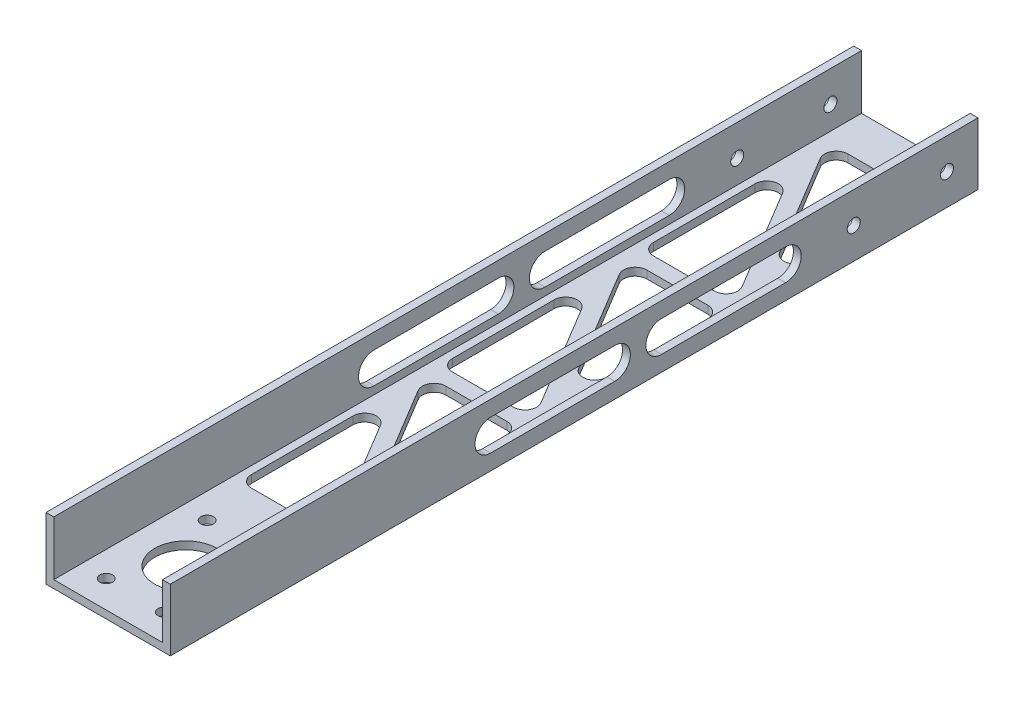
from build123d import *

# Parameters (mm, degrees)
BOSS_EXTRUDE1_DEPTH = 330.2
CUT_EXTRUDE1_REACH  = 337.049
SKETCH2_R           = 12.7
SKETCH3_R           = 2.667
CUT_EXTRUDE2_DEPTH  = 336.04901134
CUT_EXTRUDE3_REACH  = 337.049
SKETCH4_R           = 2.5908
CUT_EXTRUDE4_REACH  = 337.049
CUT_EXTRUDE5_DEPTH  = 336.04901134


with BuildPart() as part:
    # Sketch1 → Boss-Extrude1 (new body)
    with BuildSketch(Plane.XY):
        Polygon((47.625, 3.175), (47.625, 25.4), (50.8, 25.4), (50.8, 0), (0, 0), (0, 25.4), (3.175, 25.4), (3.175, 3.175), align=None)
    extrude(amount=BOSS_EXTRUDE1_DEPTH)

    # Sketch2 → Cut-Extrude1 (cut, up to next)
    with BuildSketch(Plane.XZ, mode=Mode.PRIVATE) as cut_extrude1_sk1:
        with Locations((25.4, 298.45)):
            Circle(SKETCH2_R)
    cut_extrude1_tool1 = extrude(cut_extrude1_sk1.sketch, amount=-CUT_EXTRUDE1_REACH, mode=Mode.PRIVATE) & part.part
    add(cut_extrude1_tool1.solids().sort_by_distance((25.4, 0, 298.45))[0], mode=Mode.SUBTRACT)

    # Sketch3 → Cut-Extrude2 (cut, through all)
    with BuildSketch(Plane(origin=(50.8, 0, 0), x_dir=(0, 0, -1), z_dir=(1, 0, 0))):
        with Locations((-12.7, 12.7)):
            Circle(SKETCH3_R)
        with Locations((-50.8, 12.7)):
            Circle(SKETCH3_R)
    extrude(amount=-CUT_EXTRUDE2_DEPTH, mode=Mode.SUBTRACT)

    # Sketch4 → Cut-Extrude3 (cut, up to next)
    with BuildSketch(Plane.XZ, mode=Mode.PRIVATE) as cut_extrude3_sk1:
        with Locations((13.49375, 277.827770072)):
            Circle(SKETCH4_R)
    cut_extrude3_tool1 = extrude(cut_extrude3_sk1.sketch, amount=-CUT_EXTRUDE3_REACH, mode=Mode.PRIVATE) & part.part
    # Sketch4 → Cut-Extrude3 (cut, up to next)
    with BuildSketch(Plane.XZ, mode=Mode.PRIVATE) as cut_extrude3_sk2:
        with Locations((37.30625, 277.827770072)):
            Circle(SKETCH4_R)
    cut_extrude3_tool2 = extrude(cut_extrude3_sk2.sketch, amount=-CUT_EXTRUDE3_REACH, mode=Mode.PRIVATE) & part.part
    # Sketch4 → Cut-Extrude3 (cut, up to next)
    with BuildSketch(Plane.XZ, mode=Mode.PRIVATE) as cut_extrude3_sk3:
        with Locations((13.49375, 319.072229928)):
            Circle(SKETCH4_R)
    cut_extrude3_tool3 = extrude(cut_extrude3_sk3.sketch, amount=-CUT_EXTRUDE3_REACH, mode=Mode.PRIVATE) & part.part
    # Sketch4 → Cut-Extrude3 (cut, up to next)
    with BuildSketch(Plane.XZ, mode=Mode.PRIVATE) as cut_extrude3_sk4:
        with Locations((37.30625, 319.072229928)):
            Circle(SKETCH4_R)
    cut_extrude3_tool4 = extrude(cut_extrude3_sk4.sketch, amount=-CUT_EXTRUDE3_REACH, mode=Mode.PRIVATE) & part.part
    add(cut_extrude3_tool1.solids().sort_by_distance((13.49375, 0, 277.82777))[0], mode=Mode.SUBTRACT)
    add(cut_extrude3_tool2.solids().sort_by_distance((37.30625, 0, 277.82777))[0], mode=Mode.SUBTRACT)
    add(cut_extrude3_tool3.solids().sort_by_distance((13.49375, 0, 319.07223))[0], mode=Mode.SUBTRACT)
    add(cut_extrude3_tool4.solids().sort_by_distance((37.30625, 0, 319.07223))[0], mode=Mode.SUBTRACT)

    # Sketch5 → Cut-Extrude4 (cut, up to next)
    with BuildSketch(Plane.XZ, mode=Mode.PRIVATE) as cut_extrude4_sk1:
        with BuildLine():
            Line((40.122328379, 85.773383183), (15.196310059, 44.230019316))
            ThreePointArc((15.196310059, 44.230019316), (9.841228816, 42.090613006), (6.35, 46.680305352))
            Line((6.35, 46.680305352), (6.35, 88.223669219))
            ThreePointArc((6.35, 88.223669219), (7.744903955, 91.591265264), (11.1125, 92.986169219))
            Line((11.1125, 92.986169219), (36.03851832, 92.986169219))
            ThreePointArc((36.03851832, 92.986169219), (40.182845376, 90.570147325), (40.122328379, 85.773383183))
        make_face()
    cut_extrude4_tool1 = extrude(cut_extrude4_sk1.sketch, amount=-CUT_EXTRUDE4_REACH, mode=Mode.PRIVATE) & part.part
    # Sketch5 → Cut-Extrude4 (cut, up to next)
    with BuildSketch(Plane.XZ, mode=Mode.PRIVATE) as cut_extrude4_sk2:
        with BuildLine():
            Line((14.76148168, 17.143987708), (39.6875, 17.143987708))
            ThreePointArc((39.6875, 17.143987708), (43.055096045, 18.538891662), (44.45, 21.906487708))
            Line((44.45, 21.906487708), (44.45, 63.449851575))
            ThreePointArc((44.45, 63.449851575), (40.958771184, 68.03954392), (35.603689941, 65.90013761))
            Line((35.603689941, 65.90013761), (10.677671621, 24.356773743))
            ThreePointArc((10.677671621, 24.356773743), (10.617154624, 19.560009601), (14.76148168, 17.143987708))
        make_face()
    cut_extrude4_tool2 = extrude(cut_extrude4_sk2.sketch, amount=-CUT_EXTRUDE4_REACH, mode=Mode.PRIVATE) & part.part
    # Sketch5 → Cut-Extrude4 (cut, up to next)
    with BuildSketch(Plane.XZ, mode=Mode.PRIVATE) as cut_extrude4_sk3:
        with BuildLine():
            Line((40.122328379, 167.965564694), (15.196310059, 126.422200827))
            ThreePointArc((15.196310059, 126.422200827), (9.841228816, 124.282794517), (6.35, 128.872486862))
            Line((6.35, 128.872486862), (6.35, 170.415850729))
            ThreePointArc((6.35, 170.415850729), (7.744903955, 173.783446775), (11.1125, 175.178350729))
            Line((11.1125, 175.178350729), (36.03851832, 175.178350729))
            ThreePointArc((36.03851832, 175.178350729), (40.182845376, 172.762328836), (40.122328379, 167.965564694))
        make_face()
    cut_extrude4_tool3 = extrude(cut_extrude4_sk3.sketch, amount=-CUT_EXTRUDE4_REACH, mode=Mode.PRIVATE) & part.part
    # Sketch5 → Cut-Extrude4 (cut, up to next)
    with BuildSketch(Plane.XZ, mode=Mode.PRIVATE) as cut_extrude4_sk4:
        with BuildLine():
            Line((14.76148168, 99.336169219), (39.6875, 99.336169219))
            ThreePointArc((39.6875, 99.336169219), (43.055096045, 100.731073173), (44.45, 104.098669219))
            Line((44.45, 104.098669219), (44.45, 145.642033085))
            ThreePointArc((44.45, 145.642033085), (40.958771184, 150.231725431), (35.603689941, 148.092319121))
            Line((35.603689941, 148.092319121), (10.677671621, 106.548955254))
            ThreePointArc((10.677671621, 106.548955254), (10.617154624, 101.752191112), (14.76148168, 99.336169219))
        make_face()
    cut_extrude4_tool4 = extrude(cut_extrude4_sk4.sketch, amount=-CUT_EXTRUDE4_REACH, mode=Mode.PRIVATE) & part.part
    # Sketch5 → Cut-Extrude4 (cut, up to next)
    with BuildSketch(Plane.XZ, mode=Mode.PRIVATE) as cut_extrude4_sk5:
        with BuildLine():
            Line((40.122328379, 250.157746205), (15.196310059, 208.614382338))
            ThreePointArc((15.196310059, 208.614382338), (9.841228816, 206.474976028), (6.35, 211.064668373))
            Line((6.35, 211.064668373), (6.35, 252.60803224))
            ThreePointArc((6.35, 252.60803224), (7.744903955, 255.975628285), (11.1125, 257.37053224))
            Line((11.1125, 257.37053224), (36.03851832, 257.37053224))
            ThreePointArc((36.03851832, 257.37053224), (40.182845376, 254.954510346), (40.122328379, 250.157746205))
        make_face()
    cut_extrude4_tool5 = extrude(cut_extrude4_sk5.sketch, amount=-CUT_EXTRUDE4_REACH, mode=Mode.PRIVATE) & part.part
    # Sketch5 → Cut-Extrude4 (cut, up to next)
    with BuildSketch(Plane.XZ, mode=Mode.PRIVATE) as cut_extrude4_sk6:
        with BuildLine():
            Line((14.76148168, 181.528350729), (39.6875, 181.528350729))
            ThreePointArc((39.6875, 181.528350729), (43.055096045, 182.923254684), (44.45, 186.290850729))
            Line((44.45, 186.290850729), (44.45, 227.834214596))
            ThreePointArc((44.45, 227.834214596), (40.958771184, 232.423906942), (35.603689941, 230.284500631))
            Line((35.603689941, 230.284500631), (10.677671621, 188.741136765))
            ThreePointArc((10.677671621, 188.741136765), (10.617154624, 183.944372623), (14.76148168, 181.528350729))
        make_face()
    cut_extrude4_tool6 = extrude(cut_extrude4_sk6.sketch, amount=-CUT_EXTRUDE4_REACH, mode=Mode.PRIVATE) & part.part
    add(cut_extrude4_tool1.solids().sort_by_distance((19.256233, 0, 73.00095))[0], mode=Mode.SUBTRACT)
    add(cut_extrude4_tool2.solids().sort_by_distance((31.543767, 0, 37.129207))[0], mode=Mode.SUBTRACT)
    add(cut_extrude4_tool3.solids().sort_by_distance((19.256233, 0, 155.193132))[0], mode=Mode.SUBTRACT)
    add(cut_extrude4_tool4.solids().sort_by_distance((31.543767, 0, 119.321388))[0], mode=Mode.SUBTRACT)
    add(cut_extrude4_tool5.solids().sort_by_distance((19.256233, 0, 237.385313))[0], mode=Mode.SUBTRACT)
    add(cut_extrude4_tool6.solids().sort_by_distance((31.543767, 0, 201.51357))[0], mode=Mode.SUBTRACT)

    # Sketch6 → Cut-Extrude5 (cut, through all)
    with BuildSketch(Plane.ZY):
        with BuildLine():
            Line((78.616971835, 19.05), (129.416971835, 19.05))
            ThreePointArc((129.416971835, 19.05), (135.766971835, 12.7), (129.416971835, 6.35))
            Line((129.416971835, 6.35), (78.616971835, 6.35))
            ThreePointArc((78.616971835, 6.35), (72.266971835, 12.7), (78.616971835, 19.05))
        make_face()
        with BuildLine():
            Line((148.466971835, 19.05), (199.266971835, 19.05))
            ThreePointArc((199.266971835, 19.05), (205.616971835, 12.7), (199.266971835, 6.35))
            Line((199.266971835, 6.35), (148.466971835, 6.35))
            ThreePointArc((148.466971835, 6.35), (142.116971835, 12.7), (148.466971835, 19.05))
        make_face()
    extrude(amount=-CUT_EXTRUDE5_DEPTH, mode=Mode.SUBTRACT)


solid = part.part
